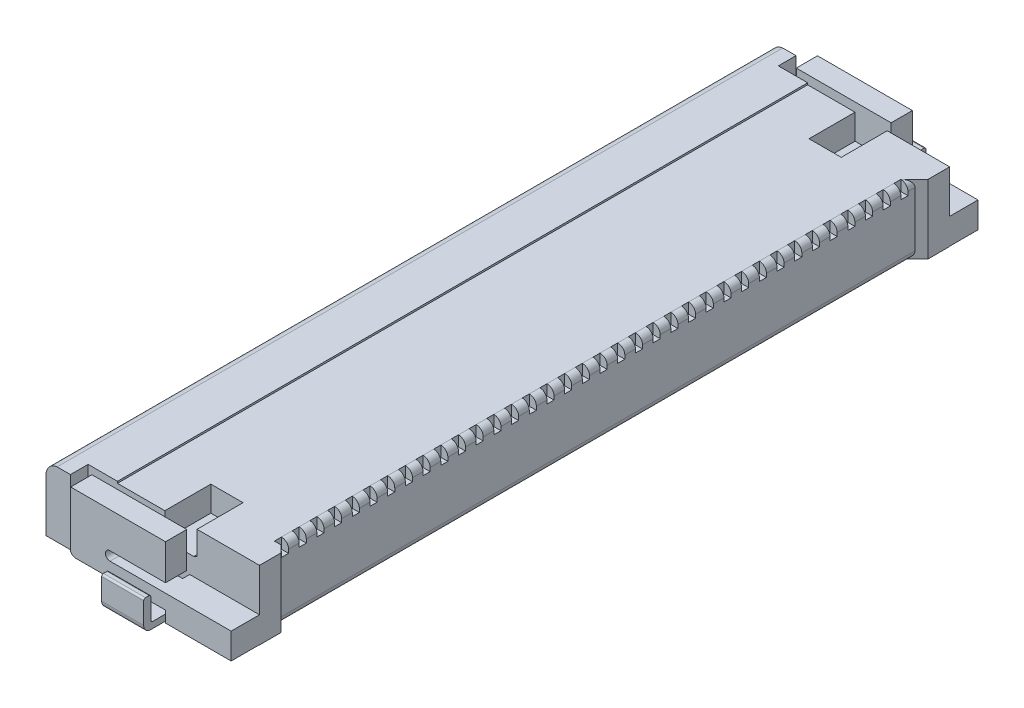
from build123d import *

# Parameters (mm, degrees)
BOSS_EXTRUDE1_DEPTH  = 0.6
BOSS_EXTRUDE2_DEPTH  = 0.8
SKETCH8_W            = 1.187106534
SKETCH8_H            = 0.413578876
BOSS_EXTRUDE3_DEPTH  = 0.6
BOSS_EXTRUDE5_DEPTH  = 1.999195913
CUT_EXTRUDE6_DEPTH   = 1.3
SKETCH19_W           = 9.75
SKETCH19_H           = 1.999195913
BOSS_EXTRUDE6_DEPTH  = 0.963004
BOSS_EXTRUDE7_DEPTH  = 9.75
CUT_EXTRUDE7_DEPTH   = 9.75
BOSS_EXTRUDE8_DEPTH  = 0.5
CUT_EXTRUDE8_DEPTH   = 0.05
FILLET4_R            = 0.2
BOSS_EXTRUDE9_DEPTH  = 0.5
SKETCH27_W           = 1.187106534
SKETCH27_H           = 0.682337146
BOSS_EXTRUDE10_DEPTH = 0.2
FILLET6_R            = 0.2
FILLET7_R            = 0.05
BOSS_EXTRUDE11_DEPTH = 1.187106534
FILLET6_OF_MIRROR6_R = 0.2
FILLET7_OF_MIRROR6_R = 0.05
FILLET8_R            = 0.05
FILLET9_R            = 0.05
SKETCH29_W           = 1.077460628
SKETCH29_H           = 0.2
CUT_EXTRUDE9_DEPTH   = 0.3
CUT_EXTRUDE10_DEPTH  = 0.68797799
SKETCH31_W           = 0.2
SKETCH31_H           = 0.54
BOSS_EXTRUDE12_DEPTH = 0.05
SKETCH32_W           = 0.2
SKETCH32_H           = 0.157201276
BOSS_EXTRUDE13_DEPTH = 0.01
LPATTERN1_COUNT      = 36
LPATTERN1_PITCH      = 0.5


with BuildPart() as part:
    # Sketch5 → Boss-Extrude1 (new body)
    with BuildSketch(Plane.XY):
        with BuildLine():
            Line((1.03647469, 0.909619652), (1.03647469, 0.476981472))
            add(Edge.make_bspline(
                [(1.184733339, 0.385802819), (1.081992039, 0.388557453), (1.03647469, 0.476981472)],
                knots=[0, 0, 0, 1, 1, 1], degree=2))
            Line((1.184733339, 0.385802819), (2.412634415, 0.385802819))
            Line((2.412634415, 0.385802819), (2.412634415, 0.799381695))
            Line((2.412634415, 0.799381695), (2.14625929, 0.799381695))
            ThreePointArc((2.14625929, 0.799381695), (2.018862492, 0.926778494), (2.14625929, 1.054175292))
            Line((2.14625929, 1.054175292), (3.715556221, 1.054175292))
            Line((3.715556221, 1.054175292), (3.715556221, 1.297888432))
            Line((3.715556221, 1.297888432), (3.715556221, 2.059195913))
            Line((3.715556221, 2.059195913), (1.03647469, 2.059195913))
            Line((1.03647469, 2.059195913), (1.03647469, 1.21340623))
            Line((1.03647469, 1.21340623), (1.03647469, 0.909619652))
        make_face()
    boss_extrude1 = extrude(amount=-BOSS_EXTRUDE1_DEPTH)



with BuildPart() as body_2:
    # Sketch7 → Boss-Extrude2 (new body)
    with BuildSketch(Plane.XY):
        Polygon((3.715556221, 0.067073076), (5.570517707, 0.067073076), (5.570517707, 0.174952185), (5.570517707, 0.799381695), (3.599740949, 0.799381695), (3.599740949, 0.385802819), (3.715556221, 0.385802819), (3.715556221, 0.174952185), align=None)
    boss_extrude2 = extrude(amount=-BOSS_EXTRUDE2_DEPTH)


with BuildPart() as part_1:
    add(part.part)

    add(body_2.part)  # Boss-Extrude3 merges body 2
    # Sketch8 → Boss-Extrude3 (add)
    with BuildSketch(Plane.XY):
        with Locations((3.006187682, 0.592592257)):
            Rectangle(SKETCH8_W, SKETCH8_H)
    boss_extrude3 = extrude(amount=-BOSS_EXTRUDE3_DEPTH)

    # Sketch13 → Boss-Extrude5 (add)
    with BuildSketch(Plane(origin=(0, 0.06, 0), x_dir=(1, 0, 0), z_dir=(0, 1, 0))):
        Polygon((5.307650665, 10.55), (1.692449276, 10.55), (1.692449276, 0.8), (5.570517707, 0.8), (5.570517707, 1.413103506), (5.3880831, 1.595538113), (5.3880831, 10.55), align=None)
    boss_extrude5 = extrude(amount=BOSS_EXTRUDE5_DEPTH)

    # Sketch17 → Cut-Extrude6 (cut)
    with BuildSketch(Plane.XY.offset(-0.8)):
        Polygon((3.806395908, 1.34820616), (3.715556221, 1.297888432), (2.896280475, 1.297888432), (2.896280475, 2.059195913), (3.806395908, 2.059195913), align=None)
    cut_extrude6 = extrude(amount=-CUT_EXTRUDE6_DEPTH, mode=Mode.SUBTRACT)



with BuildPart() as body_2_2:
    # Sketch19 → Boss-Extrude6 (new body)
    with BuildSketch(Plane.ZY.offset(-1.692449276)):
        with Locations((-5.675, 1.059597956)):
            Rectangle(SKETCH19_W, SKETCH19_H)
    boss_extrude6 = extrude(amount=BOSS_EXTRUDE6_DEPTH)

    # Sketch18 → Boss-Extrude7 (add)
    with BuildSketch(Plane.XY.offset(-0.8)):
        with BuildLine():
            Line((0.041467015, 1.670216776), (0.041467015, 0.219865316))
            Line((0.041467015, 0.219865316), (0.729445005, 0.219865316))
            Line((0.729445005, 0.219865316), (0.729445005, 0.909619652))
            Line((0.729445005, 0.909619652), (0.729445005, 2.059195913))
            Line((0.729445005, 2.059195913), (0.352729657, 2.059195913))
            ThreePointArc((0.352729657, 2.059195913), (0.116538119, 1.929170948), (0.041467015, 1.670216776))
        make_face()
    boss_extrude7 = extrude(amount=-BOSS_EXTRUDE7_DEPTH)

    # Sketch20 → Cut-Extrude7 (cut)
    with BuildSketch(Plane.XY.offset(-0.8)):
        Polygon((1.03647469, 0.067073076), (1.03647469, 0.909619652), (0.729445005, 0.909619652), (0.729445005, 0.219865316), (0.729445005, 0.06), (0.729445005, -0.020267982), (1.03647469, -0.020267982), align=None)
    cut_extrude7 = extrude(amount=-CUT_EXTRUDE7_DEPTH, mode=Mode.SUBTRACT)

    # Sketch21 → Boss-Extrude8 (add)
    with BuildSketch(Plane.XY.offset(-0.8)):
        with BuildLine():
            Line((0.729445005, 0.219865316), (0.729445005, 0.909619652))
            Line((0.729445005, 0.909619652), (0.729445005, 2.059195913))
            Line((0.729445005, 2.059195913), (0.352729657, 2.059195913))
            ThreePointArc((0.352729657, 2.059195913), (0.116538119, 1.929170948), (0.041467015, 1.670216776))
            Line((0.041467015, 1.670216776), (0.041467015, 0.219865316))
            Line((0.041467015, 0.219865316), (0.729445005, 0.219865316))
        make_face()
    boss_extrude8 = extrude(amount=BOSS_EXTRUDE8_DEPTH)


with BuildPart() as part_2:
    add(part_1.part)

    add(body_2_2.part)  # Mirror1 merges body 2 2
    # Mirror1: Boss-Extrude1, Boss-Extrude2, Boss-Extrude3, Boss-Extrude5 across Plane3
    add(boss_extrude1.mirror(Plane.XY.offset(-10.55)))
    add(boss_extrude2.mirror(Plane.XY.offset(-10.55)))
    add(boss_extrude3.mirror(Plane.XY.offset(-10.55)))
    add(boss_extrude5.mirror(Plane.XY.offset(-10.55)))

    # Mirror1 2: Cut-Extrude6 across Plane3
    add(cut_extrude6.mirror(Plane.XY.offset(-10.55)), mode=Mode.SUBTRACT)

    # Mirror1 3: Boss-Extrude6, Boss-Extrude7 across Plane3
    add(boss_extrude6.mirror(Plane.XY.offset(-10.55)))
    add(boss_extrude7.mirror(Plane.XY.offset(-10.55)))

    # Mirror1 4: Cut-Extrude7 across Plane3
    add(cut_extrude7.mirror(Plane.XY.offset(-10.55)), mode=Mode.SUBTRACT)

    # Mirror1 5: Boss-Extrude8 across Plane3
    add(boss_extrude8.mirror(Plane.XY.offset(-10.55)))

    # Sketch22 → Cut-Extrude8 (cut)
    with BuildSketch(Plane(origin=(0, 2.059195913, 0), x_dir=(1, 0, 0), z_dir=(0, 1, 0))):
        Polygon((2.896280475, 20.3), (1.558180163, 20.3), (1.558180163, 0.8), (2.896280475, 0.8), (2.896280475, 2.1), (3.806395908, 2.1), (3.806395908, 0.8), (5.570517707, 0.8), (5.570517707, 1.413103506), (5.3880831, 1.595538113), (5.3880831, 19.504461887), (5.570517707, 19.686896494), (5.570517707, 20.3), (3.806395908, 20.3), (3.806395908, 19), (2.896280475, 19), align=None)
    extrude(amount=-CUT_EXTRUDE8_DEPTH, mode=Mode.SUBTRACT)

    # Fillet4
    fillet4_edges = [part_2.edges().sort_by_distance(p)[0] for p in [
        (5.3880831, 0.06, -10.55),
        (5.3880831, 2.009195913, -10.55),
    ]]
    fillet(fillet4_edges, radius=FILLET4_R)



with BuildPart() as body_2_3:
    # Sketch26 → Boss-Extrude9 (new body)
    with BuildSketch(Plane.XY):
        Polygon((2.412634415, 0.174952185), (2.412634415, 0.067073076), (2.412634415, 0), (3.599740949, 0), (3.599740949, 0.067073076), (3.599740949, 0.174952185), align=None)
    boss_extrude9 = extrude(amount=BOSS_EXTRUDE9_DEPTH)

    # Sketch27 → Boss-Extrude10 (add)
    with BuildSketch(Plane.XY.offset(0.5)):
        with Locations((3.006187682, 0.516120758)):
            Rectangle(SKETCH27_W, SKETCH27_H)
    boss_extrude10 = extrude(amount=-BOSS_EXTRUDE10_DEPTH)

    # Fillet6
    fillet6_edges = [body_2_3.edges().sort_by_distance(p)[0] for p in [
        (3.006187682, 0, 0.5),
    ]]
    fillet(fillet6_edges, radius=FILLET6_R)

    # Fillet7
    fillet7_edges = [body_2_3.edges().sort_by_distance(p)[0] for p in [
        (3.006187682, 0.857289331, 0.3),
        (3.006187682, 0.857289331, 0.5),
    ]]
    fillet(fillet7_edges, radius=FILLET7_R)


with BuildPart() as part_3:
    add(part_2.part)

    add(body_2_3.part)  # Boss-Extrude11 merges body 2 3
    # Sketch28 → Boss-Extrude11 (add)
    with BuildSketch(Plane.ZY.offset(-2.412634415)):
        with BuildLine():
            Line((-0.8, 0.323306936), (-0.8, 0.139277214))
            ThreePointArc((-0.8, 0.139277214), (-0.690012763, 0.045403916), (-0.552725208, 0))
            Line((-0.552725208, 0), (0, 0))
            Line((0, 0), (0, 0.174952185))
            Line((0, 0.174952185), (-0.552725208, 0.174952185))
            ThreePointArc((-0.552725208, 0.174952185), (-0.689100625, 0.227898076), (-0.8, 0.323306936))
        make_face()
    boss_extrude11 = extrude(amount=-BOSS_EXTRUDE11_DEPTH)

    # Mirror6: Boss-Extrude9, Boss-Extrude10, Boss-Extrude11 across plane
    add(boss_extrude9.mirror(Plane.XY.offset(-10.55)))
    add(boss_extrude10.mirror(Plane.XY.offset(-10.55)))
    add(boss_extrude11.mirror(Plane.XY.offset(-10.55)))

    # Fillet6 of Mirror6
    fillet6_of_mirror6_edges = [part_3.edges().sort_by_distance(p)[0] for p in [
        (3.006187682, 0, -21.6),
    ]]
    fillet(fillet6_of_mirror6_edges, radius=FILLET6_OF_MIRROR6_R)

    # Fillet7 of Mirror6
    fillet7_of_mirror6_edges = [part_3.edges().sort_by_distance(p)[0] for p in [
        (3.006187682, 0.857289331, -21.4),
        (3.006187682, 0.857289331, -21.6),
    ]]
    fillet(fillet7_of_mirror6_edges, radius=FILLET7_OF_MIRROR6_R)

    # Fillet8
    fillet8_edges = [part_3.edges().sort_by_distance(p)[0] for p in [
        (3.006187682, 0.174952185, 0.3),
    ]]
    fillet(fillet8_edges, radius=FILLET8_R)

    # Fillet9
    fillet9_edges = [part_3.edges().sort_by_distance(p)[0] for p in [
        (3.006187682, 0.174952185, -21.4),
    ]]
    fillet(fillet9_edges, radius=FILLET9_R)

    # Sketch29 → Cut-Extrude9 (cut)
    with BuildSketch(Plane(origin=(0, 2.009195913, 0), x_dir=(1, 0, 0), z_dir=(0, 1, 0))):
        with Locations((5.726813414, 18.704461887)):
            Rectangle(SKETCH29_W, SKETCH29_H)
        with Locations((5.726813414, 19.204461887)):
            Rectangle(SKETCH29_W, SKETCH29_H)
        with Locations((5.726813414, 18.204461887)):
            Rectangle(SKETCH29_W, SKETCH29_H)
        with Locations((5.726813414, 17.704461887)):
            Rectangle(SKETCH29_W, SKETCH29_H)
        with Locations((5.726813414, 17.204461887)):
            Rectangle(SKETCH29_W, SKETCH29_H)
        with Locations((5.726813414, 16.704461887)):
            Rectangle(SKETCH29_W, SKETCH29_H)
        with Locations((5.726813414, 16.204461887)):
            Rectangle(SKETCH29_W, SKETCH29_H)
        with Locations((5.726813414, 15.704461887)):
            Rectangle(SKETCH29_W, SKETCH29_H)
        with Locations((5.726813414, 15.204461887)):
            Rectangle(SKETCH29_W, SKETCH29_H)
        with Locations((5.726813414, 14.704461887)):
            Rectangle(SKETCH29_W, SKETCH29_H)
        with Locations((5.726813414, 14.204461887)):
            Rectangle(SKETCH29_W, SKETCH29_H)
        with Locations((5.726813414, 13.704461887)):
            Rectangle(SKETCH29_W, SKETCH29_H)
        with Locations((5.726813414, 13.204461887)):
            Rectangle(SKETCH29_W, SKETCH29_H)
        with Locations((5.726813414, 12.704461887)):
            Rectangle(SKETCH29_W, SKETCH29_H)
        with Locations((5.726813414, 12.204461887)):
            Rectangle(SKETCH29_W, SKETCH29_H)
        with Locations((5.726813414, 11.704461887)):
            Rectangle(SKETCH29_W, SKETCH29_H)
        with Locations((5.726813414, 11.204461887)):
            Rectangle(SKETCH29_W, SKETCH29_H)
        with Locations((5.726813414, 10.704461887)):
            Rectangle(SKETCH29_W, SKETCH29_H)
        with Locations((5.726813414, 10.204461887)):
            Rectangle(SKETCH29_W, SKETCH29_H)
        with Locations((5.726813414, 9.704461887)):
            Rectangle(SKETCH29_W, SKETCH29_H)
        with Locations((5.726813414, 9.204461887)):
            Rectangle(SKETCH29_W, SKETCH29_H)
        with Locations((5.726813414, 8.704461887)):
            Rectangle(SKETCH29_W, SKETCH29_H)
        with Locations((5.726813414, 8.204461887)):
            Rectangle(SKETCH29_W, SKETCH29_H)
        with Locations((5.726813414, 7.704461887)):
            Rectangle(SKETCH29_W, SKETCH29_H)
        with Locations((5.726813414, 7.204461887)):
            Rectangle(SKETCH29_W, SKETCH29_H)
        with Locations((5.726813414, 6.704461887)):
            Rectangle(SKETCH29_W, SKETCH29_H)
        with Locations((5.726813414, 6.204461887)):
            Rectangle(SKETCH29_W, SKETCH29_H)
        with Locations((5.726813414, 5.704461887)):
            Rectangle(SKETCH29_W, SKETCH29_H)
        with Locations((5.726813414, 5.204461887)):
            Rectangle(SKETCH29_W, SKETCH29_H)
        with Locations((5.726813414, 4.704461887)):
            Rectangle(SKETCH29_W, SKETCH29_H)
        with Locations((5.726813414, 4.204461887)):
            Rectangle(SKETCH29_W, SKETCH29_H)
        with Locations((5.726813414, 3.704461887)):
            Rectangle(SKETCH29_W, SKETCH29_H)
        with Locations((5.726813414, 3.204461887)):
            Rectangle(SKETCH29_W, SKETCH29_H)
        with Locations((5.726813414, 2.704461887)):
            Rectangle(SKETCH29_W, SKETCH29_H)
        with Locations((5.726813414, 2.204461887)):
            Rectangle(SKETCH29_W, SKETCH29_H)
        with Locations((5.726813414, 1.704461887)):
            Rectangle(SKETCH29_W, SKETCH29_H)
    extrude(amount=-CUT_EXTRUDE9_DEPTH, mode=Mode.SUBTRACT)

    # Sketch30 → Cut-Extrude10 (cut)
    with BuildSketch(Plane.ZY.offset(-0.041467015)):
        Polygon((-19.835, 0.909619652), (-19.835, 0.219865316), (-10.55, 0.219865316), (-10.55, 1.229619652), (-18.505, 1.229619652), (-18.505, 0.909619652), align=None)
        Polygon((-10.55, 1.229619652), (-10.55, 0.219865316), (-1.265, 0.219865316), (-1.265, 0.909619652), (-2.595, 0.909619652), (-2.595, 1.229619652), align=None)
    extrude(amount=-CUT_EXTRUDE10_DEPTH, mode=Mode.SUBTRACT)

    # Sketch31 → Boss-Extrude12 (add)
    with BuildSketch(Plane.ZY.offset(-1.03647469)):
        with Locations((-19.285, 0.639619652)):
            Rectangle(SKETCH31_W, SKETCH31_H)
        with Locations((-18.785, 0.639619652)):
            Rectangle(SKETCH31_W, SKETCH31_H)
        with Locations((-18.285, 0.639619652)):
            Rectangle(SKETCH31_W, SKETCH31_H)
        with Locations((-17.785, 0.639619652)):
            Rectangle(SKETCH31_W, SKETCH31_H)
        with Locations((-17.285, 0.639619652)):
            Rectangle(SKETCH31_W, SKETCH31_H)
        with Locations((-16.785, 0.639619652)):
            Rectangle(SKETCH31_W, SKETCH31_H)
        with Locations((-16.285, 0.639619652)):
            Rectangle(SKETCH31_W, SKETCH31_H)
        with Locations((-15.785, 0.639619652)):
            Rectangle(SKETCH31_W, SKETCH31_H)
        with Locations((-15.285, 0.639619652)):
            Rectangle(SKETCH31_W, SKETCH31_H)
        with Locations((-14.785, 0.639619652)):
            Rectangle(SKETCH31_W, SKETCH31_H)
        with Locations((-14.285, 0.639619652)):
            Rectangle(SKETCH31_W, SKETCH31_H)
        with Locations((-13.785, 0.639619652)):
            Rectangle(SKETCH31_W, SKETCH31_H)
        with Locations((-13.285, 0.639619652)):
            Rectangle(SKETCH31_W, SKETCH31_H)
        with Locations((-12.785, 0.639619652)):
            Rectangle(SKETCH31_W, SKETCH31_H)
        with Locations((-12.285, 0.639619652)):
            Rectangle(SKETCH31_W, SKETCH31_H)
        with Locations((-11.785, 0.639619652)):
            Rectangle(SKETCH31_W, SKETCH31_H)
        with Locations((-11.285, 0.639619652)):
            Rectangle(SKETCH31_W, SKETCH31_H)
        with Locations((-10.785, 0.639619652)):
            Rectangle(SKETCH31_W, SKETCH31_H)
        with Locations((-10.285, 0.639619652)):
            Rectangle(SKETCH31_W, SKETCH31_H)
        with Locations((-9.785, 0.639619652)):
            Rectangle(SKETCH31_W, SKETCH31_H)
        with Locations((-9.285, 0.639619652)):
            Rectangle(SKETCH31_W, SKETCH31_H)
        with Locations((-8.785, 0.639619652)):
            Rectangle(SKETCH31_W, SKETCH31_H)
        with Locations((-8.285, 0.639619652)):
            Rectangle(SKETCH31_W, SKETCH31_H)
        with Locations((-7.785, 0.639619652)):
            Rectangle(SKETCH31_W, SKETCH31_H)
        with Locations((-7.285, 0.639619652)):
            Rectangle(SKETCH31_W, SKETCH31_H)
        with Locations((-6.785, 0.639619652)):
            Rectangle(SKETCH31_W, SKETCH31_H)
        with Locations((-6.285, 0.639619652)):
            Rectangle(SKETCH31_W, SKETCH31_H)
        with Locations((-5.785, 0.639619652)):
            Rectangle(SKETCH31_W, SKETCH31_H)
        with Locations((-5.285, 0.639619652)):
            Rectangle(SKETCH31_W, SKETCH31_H)
        with Locations((-4.785, 0.639619652)):
            Rectangle(SKETCH31_W, SKETCH31_H)
        with Locations((-4.285, 0.639619652)):
            Rectangle(SKETCH31_W, SKETCH31_H)
        with Locations((-3.785, 0.639619652)):
            Rectangle(SKETCH31_W, SKETCH31_H)
        with Locations((-3.285, 0.639619652)):
            Rectangle(SKETCH31_W, SKETCH31_H)
        with Locations((-2.785, 0.639619652)):
            Rectangle(SKETCH31_W, SKETCH31_H)
        with Locations((-2.285, 0.639619652)):
            Rectangle(SKETCH31_W, SKETCH31_H)
        with Locations((-1.785, 0.639619652)):
            Rectangle(SKETCH31_W, SKETCH31_H)
    extrude(amount=BOSS_EXTRUDE12_DEPTH)

    # Sketch32 → Boss-Extrude13 (add)
    with BuildSketch(Plane.ZY.offset(-0.98647469)):
        with Locations((-19.285, 0.71822029)):
            Rectangle(SKETCH32_W, SKETCH32_H)
    boss_extrude13 = extrude(amount=BOSS_EXTRUDE13_DEPTH)

    # LPattern1: Boss-Extrude13 ×36
    with Locations(*[(0, 0, i * LPATTERN1_PITCH) for i in range(1, LPATTERN1_COUNT)]):
        add(boss_extrude13)


solid = part_3.part
